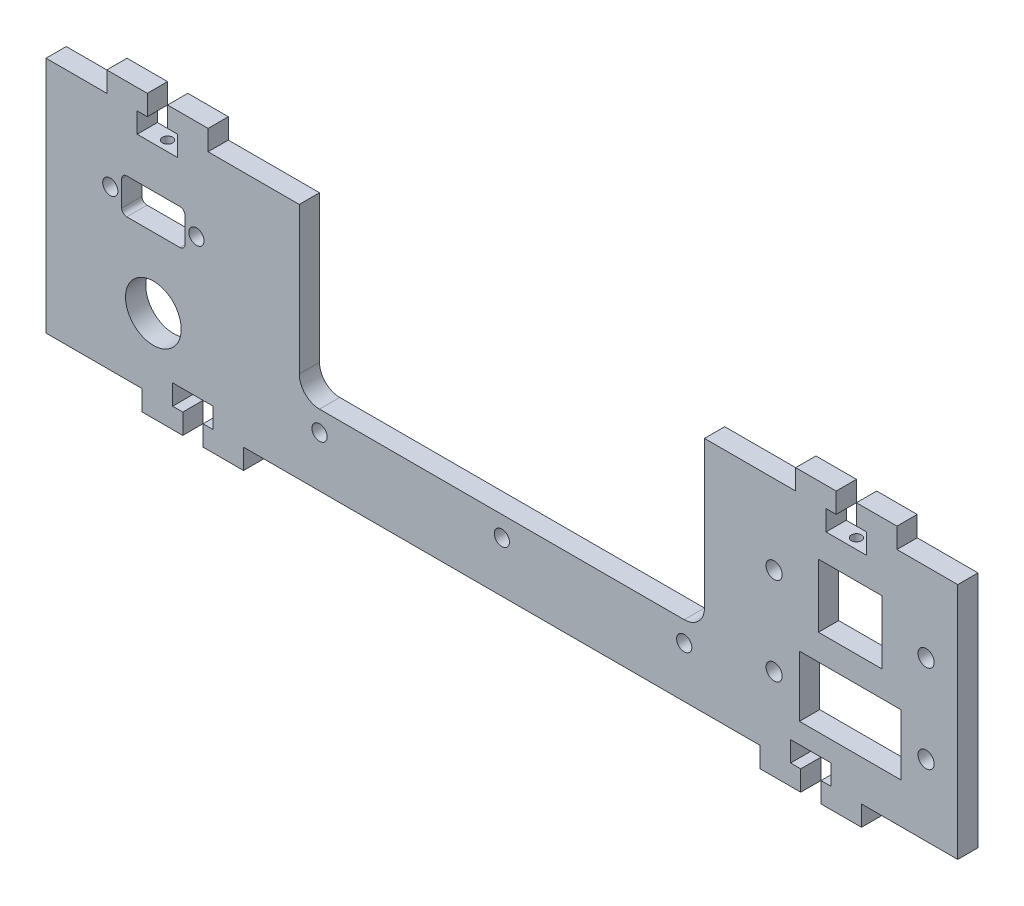
from build123d import *

# Parameters (mm, degrees)
SKETCH_1_R             = 1.6
SKETCH_1_R_2           = 5.5
SKETCH_1_R_3           = 1.5
SKETCH_1_W             = 12.5
SKETCH_1_H             = 12.5
SKETCH_1_W_2           = 20
SKETCH_1_H_2           = 12
SM_BASE_FLANGE_1_DEPTH = 4
SKETCH_6_R             = 1
CUT_EXTRUDE_1_DEPTH    = 10
SKETCH_7_R             = 1
CUT_EXTRUDE_2_DEPTH    = 10


# Sheet-metal steps are written as plain solids
with BuildPart() as part:
    # Sketch 1 → Базовая кромка1 (new body)
    with BuildSketch(Plane.XY):
        with BuildLine():
            Line((0, 0), (12, 0))
            Line((12, 0), (12, 4))
            Line((12, 4), (20, 4))
            Line((20, 4), (20, 0))
            Line((20, 0), (18, 0))
            Line((18, 0), (18, -4))
            Line((18, -4), (26, -4))
            Line((26, -4), (26, 0))
            Line((26, 0), (24, 0))
            Line((24, 0), (24, 4))
            Line((24, 4), (32, 4))
            Line((32, 4), (32, 0))
            Line((32, 0), (50, 0))
            Line((50, 0), (50, -29))
            ThreePointArc((50, -29), (51.171572875, -31.828427125), (54, -33))
            Line((54, -33), (126, -33))
            ThreePointArc((126, -33), (128.828427125, -31.828427125), (130, -29))
            Line((130, -29), (130, 0))
            Line((130, 0), (148, 0))
            Line((148, 0), (148, 4))
            Line((148, 4), (156, 4))
            Line((156, 4), (156, 0))
            Line((156, 0), (154, 0))
            Line((154, 0), (154, -4))
            Line((154, -4), (162, -4))
            Line((162, -4), (162, 0))
            Line((162, 0), (160, 0))
            Line((160, 0), (160, 4))
            Line((160, 4), (168, 4))
            Line((168, 4), (168, 0))
            Line((168, 0), (180, 0))
            Line((180, 0), (180, -47))
            Line((180, -47), (161, -47))
            Line((161, -47), (161, -51))
            Line((161, -51), (153, -51))
            Line((153, -51), (153, -47))
            Line((153, -47), (155, -47))
            Line((155, -47), (155, -43))
            Line((155, -43), (147, -43))
            Line((147, -43), (147, -47))
            Line((147, -47), (149, -47))
            Line((149, -47), (149, -51))
            Line((149, -51), (141, -51))
            Line((141, -51), (141, -47))
            Line((141, -47), (90, -47))
            Line((90, -47), (39, -47))
            Line((39, -47), (39, -51))
            Line((39, -51), (31, -51))
            Line((31, -51), (31, -47))
            Line((31, -47), (33, -47))
            Line((33, -47), (33, -43))
            Line((33, -43), (25, -43))
            Line((25, -43), (25, -47))
            Line((25, -47), (27, -47))
            Line((27, -47), (27, -51))
            Line((27, -51), (19, -51))
            Line((19, -51), (19, -47))
            Line((19, -47), (0, -47))
            Line((0, -47), (0, 0))
        make_face()
        with Locations((143.75, -15.647183543)):
            Circle(SKETCH_1_R, mode=Mode.SUBTRACT)
        with Locations((173.75, -15.647183543)):
            Circle(SKETCH_1_R, mode=Mode.SUBTRACT)
        with Locations((143.75, -33)):
            Circle(SKETCH_1_R, mode=Mode.SUBTRACT)
        with Locations((173.75, -33)):
            Circle(SKETCH_1_R, mode=Mode.SUBTRACT)
        with Locations((21.194446521, -33)):
            Circle(SKETCH_1_R_2, mode=Mode.SUBTRACT)
        with Locations((90, -37)):
            Circle(SKETCH_1_R_3, mode=Mode.SUBTRACT)
        with Locations((54, -37)):
            Circle(SKETCH_1_R_3, mode=Mode.SUBTRACT)
        with Locations((126, -37)):
            Circle(SKETCH_1_R_3, mode=Mode.SUBTRACT)
        with Locations((12.694446521, -15.647183543)):
            Circle(SKETCH_1_R_3, mode=Mode.SUBTRACT)
        with Locations((29.694446521, -15.647183543)):
            Circle(SKETCH_1_R_3, mode=Mode.SUBTRACT)
        with Locations((158.75, -15.647183543)):
            Rectangle(SKETCH_1_W, SKETCH_1_H, mode=Mode.SUBTRACT)
        with Locations((158.75, -33)):
            Rectangle(SKETCH_1_W_2, SKETCH_1_H_2, mode=Mode.SUBTRACT)
        with BuildLine():
            Line((15.944446521, -12.147183543), (26.444446521, -12.147183543))
            ThreePointArc((26.444446521, -12.147183543), (27.151553303, -12.440076762), (27.444446521, -13.147183543))
            Line((27.444446521, -13.147183543), (27.444446521, -18.147183543))
            ThreePointArc((27.444446521, -18.147183543), (27.151553303, -18.854290324), (26.444446521, -19.147183543))
            Line((26.444446521, -19.147183543), (15.944446521, -19.147183543))
            ThreePointArc((15.944446521, -19.147183543), (15.23733974, -18.854290324), (14.944446521, -18.147183543))
            Line((14.944446521, -18.147183543), (14.944446521, -13.147183543))
            ThreePointArc((14.944446521, -13.147183543), (15.23733974, -12.440076762), (15.944446521, -12.147183543))
        make_face(mode=Mode.SUBTRACT)
    extrude(amount=-SM_BASE_FLANGE_1_DEPTH)

    # Эскиз6 → Вырез-Вытянуть1 (cut)
    with BuildSketch(Plane(origin=(0, 4, 0), x_dir=(1, 0, 0), z_dir=(0, 1, 0))):
        with Locations(Location((22, 2, 0), (0, 0, 180))):
            Circle(SKETCH_6_R)
        with Locations(Location((158, 2, 0), (0, 0, 180))):
            Circle(SKETCH_6_R)
    extrude(amount=-CUT_EXTRUDE_1_DEPTH, mode=Mode.SUBTRACT)

    # Эскиз7 → Вырез-Вытянуть2 (cut)
    with BuildSketch(Plane.XZ.offset(51)):
        with Locations(Location((29, -2, 0), (0, 0, 270))):
            Circle(SKETCH_7_R)
        with Locations(Location((151, -2, 0), (0, 0, 270))):
            Circle(SKETCH_7_R)
    extrude(amount=-CUT_EXTRUDE_2_DEPTH, mode=Mode.SUBTRACT)


solid = part.part
